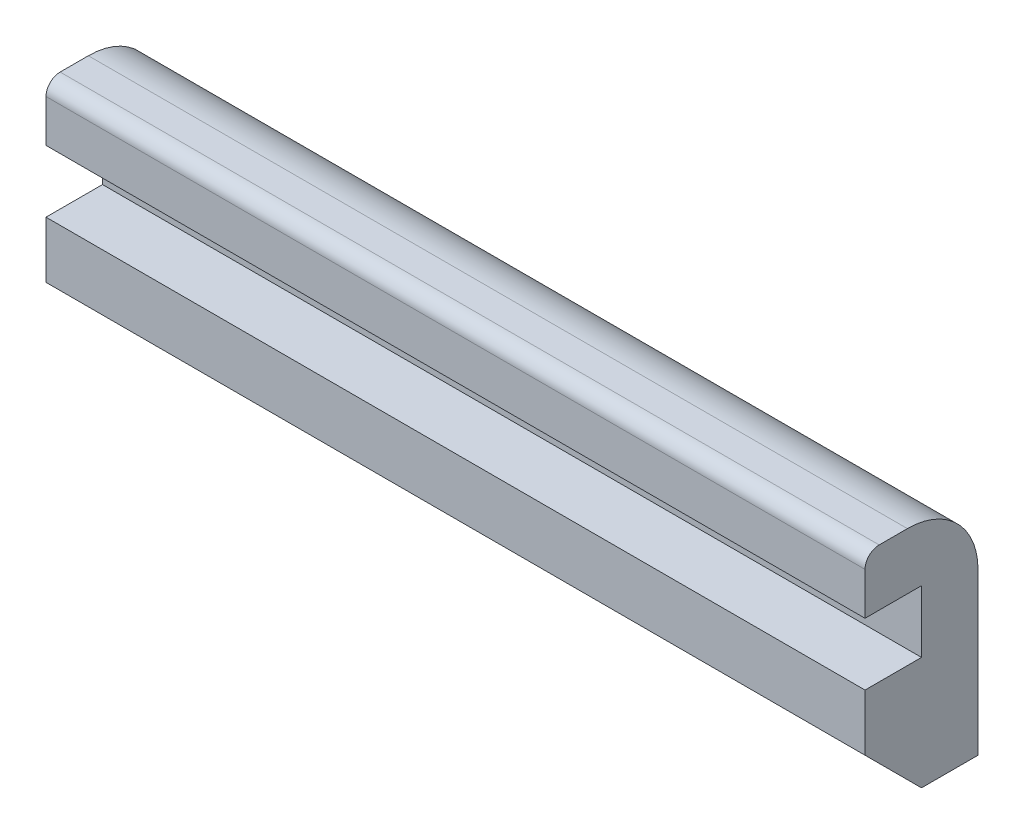
from build123d import *

# Parameters (mm, degrees)
SKETCH1_W                       = 39
SKETCH1_H                       = 155
BOSS_EXTRUDE1_DEPTH             = 2
BOSS_EXTRUDE2_DEPTH             = 38
SKETCH3_W                       = 2
SKETCH3_H                       = 2
BOSS_EXTRUDE3_DEPTH             = 38
SKETCH4_W                       = 2
SKETCH4_H                       = 2
BOSS_EXTRUDE4_DEPTH             = 151
SKETCH6_W                       = 35
SKETCH6_H                       = 2.2
CUT_EXTRUDE1_DEPTH              = 160.340045186
SKETCH7_W                       = 35
SKETCH7_H                       = 2.2
CUT_EXTRUDE2_DEPTH              = 89.490112442
SKETCH5_W                       = 31
SKETCH5_H                       = 2
BOSS_EXTRUDE5_DEPTH             = 2
BOSS_EXTRUDE6_REACH             = 91.367
SKETCH8_W                       = 2
SKETCH8_H                       = 2
BOSS_EXTRUDE6_DIRECTION_2_REACH = 91.367
SKETCH10_W                      = 2
SKETCH10_H                      = 2.2
SKETCH10_W_2                    = 2.2
SKETCH10_H_2                    = 2
BOSS_EXTRUDE8_DEPTH             = 2
SKETCH11_W                      = 2
SKETCH11_H                      = 2.2
SKETCH11_W_2                    = 2.2
SKETCH11_H_2                    = 2
BOSS_EXTRUDE9_DEPTH             = 2
FILLET2_R                       = 2.5
SKETCH14_W                      = 36.5
SKETCH14_H                      = 7.75
BOSS_EXTRUDE10_DEPTH            = 2
SKETCH13_W                      = 31
SKETCH13_H                      = 3
CUT_EXTRUDE4_DEPTH              = 2
FILLET3_R                       = 2
FILLET4_R                       = 0.5
SKETCH15_R                      = 5.1
CUT_EXTRUDE5_DEPTH              = 90.367219941
SKETCH16_R                      = 7.1
BOSS_EXTRUDE11_DEPTH            = 1
FILLET5_R                       = 0.5
CUT_EXTRUDE3_DEPTH              = 160.340045186
FILLET6_R                       = 0.4
FILLET7_R                       = 0.5
CUT_EXTRUDE6_DEPTH              = 6
SKETCH18_W                      = 29
SKETCH18_H                      = 3
CUT_EXTRUDE8_DEPTH              = 90.367220028
CUT_EXTRUDE11_DEPTH             = 90.367220028
CUT_EXTRUDE11_DEPTH_BACK        = 90.367220028
SKETCH20_W                      = 5
SKETCH20_H                      = 40
SKETCH21_W                      = 29
SKETCH21_H                      = 22.8
CUT_EXTRUDE12_DEPTH             = 43.594013669


with BuildPart() as part:
    # Sketch1 → Boss-Extrude1 (new body)
    with BuildSketch(Plane(origin=(0, 0, 0), x_dir=(1, 0, 0), z_dir=(0, 1, 0))):
        Rectangle(SKETCH1_W, SKETCH1_H)
    extrude(amount=BOSS_EXTRUDE1_DEPTH)

    # Sketch2 → Boss-Extrude2 (add)
    with BuildSketch(Plane(origin=(0, 2, 0), x_dir=(1, 0, 0), z_dir=(0, 1, 0))):
        Polygon((-17.5, -77.5), (-17.5, -75.5), (-17.5, 75.5), (17.5, 75.5), (17.5, -75.5), (17.5, -77.5), (19.5, -77.5), (19.5, 77.5), (-19.5, 77.5), (-19.5, -77.5), align=None)
    extrude(amount=BOSS_EXTRUDE2_DEPTH)

    # Sketch3 → Boss-Extrude3 (add)
    with BuildSketch(Plane(origin=(0, 2, 0), x_dir=(1, 0, 0), z_dir=(0, 1, 0))):
        with Locations((-16.5, -76.5)):
            Rectangle(SKETCH3_W, SKETCH3_H)
        with Locations((-16.5, -72.3)):
            Rectangle(SKETCH3_W, SKETCH3_H)
        with Locations((16.5, -76.5)):
            Rectangle(SKETCH3_W, SKETCH3_H)
        with Locations((16.5, -72.3)):
            Rectangle(SKETCH3_W, SKETCH3_H)
    extrude(amount=BOSS_EXTRUDE3_DEPTH)

    # Sketch4 → Boss-Extrude4 (add)
    with BuildSketch(Plane.XY.offset(-75.5)):
        with Locations((-16.5, 39)):
            Rectangle(SKETCH4_W, SKETCH4_H)
        Polygon((-15.5, 33.8), (-17.5, 31.8), (-17.5, 35.8), (-15.5, 35.8), align=None)
        Polygon((15.5, 35.8), (17.5, 35.8), (17.5, 31.8), (15.5, 33.8), align=None)
        with Locations((16.5, 39)):
            Rectangle(SKETCH4_W, SKETCH4_H)
    extrude(amount=BOSS_EXTRUDE4_DEPTH)

    # Sketch6 → Cut-Extrude1 (cut, through all)
    with BuildSketch(Plane.XY.offset(-75.5)):
        with Locations((0, 36.9)):
            Rectangle(SKETCH6_W, SKETCH6_H)
    extrude(amount=CUT_EXTRUDE1_DEPTH, mode=Mode.SUBTRACT)

    # Sketch7 → Cut-Extrude2 (cut, through all)
    with BuildSketch(Plane(origin=(0, 2, 0), x_dir=(1, 0, 0), z_dir=(0, 1, 0))):
        with Locations((0, -74.4)):
            Rectangle(SKETCH7_W, SKETCH7_H)
    extrude(amount=CUT_EXTRUDE2_DEPTH, mode=Mode.SUBTRACT)

    # Sketch5 → Boss-Extrude5 (add)
    with BuildSketch(Plane(origin=(0, 2, 0), x_dir=(1, 0, 0), z_dir=(0, 1, 0))):
        with Locations((0, -76.5)):
            Rectangle(SKETCH5_W, SKETCH5_H)
        with Locations((0, -72.3)):
            Rectangle(SKETCH5_W, SKETCH5_H)
    extrude(amount=BOSS_EXTRUDE5_DEPTH)

    # Boss-Extrude6: up to this face of the body (flat: up to its plane)
    boss_extrude6_end = Plane(part.part.faces().sort_by_distance((17.5, 16.9, -2.1))[0])
    # Sketch8 → Boss-Extrude6 (add, up to the picked face)
    with BuildSketch(Plane(origin=(0, 0, 0), x_dir=(0, 0, -1), z_dir=(1, 0, 0)), mode=Mode.PRIVATE) as boss_extrude6_sk1:
        with Locations((74.5, 39)):
            Rectangle(SKETCH8_W, SKETCH8_H)
    boss_extrude6_tool1 = split(extrude(boss_extrude6_sk1.sketch, amount=BOSS_EXTRUDE6_REACH, mode=Mode.PRIVATE), bisect_by=boss_extrude6_end, keep=Keep.BOTH, mode=Mode.PRIVATE)
    # Sketch8 → Boss-Extrude6 (add, up to the picked face)
    with BuildSketch(Plane(origin=(0, 0, 0), x_dir=(0, 0, -1), z_dir=(1, 0, 0)), mode=Mode.PRIVATE) as boss_extrude6_sk2:
        Polygon((75.5, 35.8), (73.5, 35.8), (73.5, 33.8), (75.5, 31.8), align=None)
    boss_extrude6_tool2 = split(extrude(boss_extrude6_sk2.sketch, amount=BOSS_EXTRUDE6_REACH, mode=Mode.PRIVATE), bisect_by=boss_extrude6_end, keep=Keep.BOTH, mode=Mode.PRIVATE)
    add(boss_extrude6_tool1.solids().sort_by(Axis((0, 39, -74.5), (1, 0, 0)))[0])
    add(boss_extrude6_tool2.solids().sort_by(Axis((0, 34.244444, -74.611111), (1, 0, 0)))[0])

    # Boss-Extrude6 direction 2: up to this face of the body (flat: up to its plane)
    boss_extrude6_direction_2_end = Plane(part.part.faces().sort_by_distance((-17.5, 16.9, -2.1))[0])
    # Sketch8 → Boss-Extrude6 direction 2 (add, up to the picked face)
    with BuildSketch(Plane(origin=(0, 0, 0), x_dir=(0, 0, -1), z_dir=(1, 0, 0)), mode=Mode.PRIVATE) as boss_extrude6_direction_2_sk1:
        with Locations((74.5, 39)):
            Rectangle(SKETCH8_W, SKETCH8_H)
    boss_extrude6_direction_2_tool1 = split(extrude(boss_extrude6_direction_2_sk1.sketch, amount=-BOSS_EXTRUDE6_DIRECTION_2_REACH, mode=Mode.PRIVATE), bisect_by=boss_extrude6_direction_2_end, keep=Keep.BOTH, mode=Mode.PRIVATE)
    # Sketch8 → Boss-Extrude6 direction 2 (add, up to the picked face)
    with BuildSketch(Plane(origin=(0, 0, 0), x_dir=(0, 0, -1), z_dir=(1, 0, 0)), mode=Mode.PRIVATE) as boss_extrude6_direction_2_sk2:
        Polygon((75.5, 35.8), (73.5, 35.8), (73.5, 33.8), (75.5, 31.8), align=None)
    boss_extrude6_direction_2_tool2 = split(extrude(boss_extrude6_direction_2_sk2.sketch, amount=-BOSS_EXTRUDE6_DIRECTION_2_REACH, mode=Mode.PRIVATE), bisect_by=boss_extrude6_direction_2_end, keep=Keep.BOTH, mode=Mode.PRIVATE)
    add(boss_extrude6_direction_2_tool1.solids().sort_by(Axis((0, 39, -74.5), (-1, 0, 0)))[0])
    add(boss_extrude6_direction_2_tool2.solids().sort_by(Axis((0, 34.244444, -74.611111), (-1, 0, 0)))[0])

    # Sketch10 → Boss-Extrude8 (add)
    with BuildSketch(Plane(origin=(-17.5, 0, 0), x_dir=(0, 0, -1), z_dir=(1, 0, 0))):
        with Locations((-76.5, 36.9)):
            Rectangle(SKETCH10_W, SKETCH10_H)
        with Locations((-74.4, 39)):
            Rectangle(SKETCH10_W_2, SKETCH10_H_2)
    extrude(amount=BOSS_EXTRUDE8_DEPTH)

    # Sketch11 → Boss-Extrude9 (add)
    with BuildSketch(Plane.ZY.offset(-17.5)):
        with Locations((76.5, 36.9)):
            Rectangle(SKETCH11_W, SKETCH11_H)
        with Locations((74.4, 39)):
            Rectangle(SKETCH11_W_2, SKETCH11_H_2)
    extrude(amount=BOSS_EXTRUDE9_DEPTH)

    # Fillet2
    fillet2_edges = [part.edges().sort_by_distance(p)[0] for p in [
        (-17.5, 16.9, 71.3),
        (17.5, 16.9, 71.3),
        (19.5, 20, 77.5),
        (-19.5, 20, 77.5),
        (-19.5, 20, -77.5),
        (-17.5, 16.9, -75.5),
        (17.5, 16.9, -75.5),
        (19.5, 20, -77.5),
        (19.5, 40, 0),
        (-19.5, 40, 0),
        (19.5, 0, 0),
        (-19.5, 0, 0),
        (0, 40, -77.5),
        (0, 0, 77.5),
        (0, 0, -77.5),
        (-17.5, 40, 77.5),
        (17.5, 40, 77.5),
    ]]
    fillet(fillet2_edges, radius=FILLET2_R)

    # Sketch14 → Boss-Extrude10 (add)
    with BuildSketch(Plane.XY.offset(-75.5)):
        with Locations((0, 5.125)):
            Rectangle(SKETCH14_W, SKETCH14_H)
    extrude(amount=BOSS_EXTRUDE10_DEPTH)

    # Sketch13 → Cut-Extrude4 (cut)
    with BuildSketch(Plane(origin=(0, 0, -77.5), x_dir=(-1, 0, 0), z_dir=(0, 0, -1))):
        with Locations((0, 5.5)):
            Rectangle(SKETCH13_W, SKETCH13_H)
    extrude(amount=-CUT_EXTRUDE4_DEPTH, mode=Mode.SUBTRACT)

    # Fillet3
    fillet3_edges = [part.edges().sort_by_distance(p)[0] for p in [
        (0, 9, -73.5),
    ]]
    fillet(fillet3_edges, radius=FILLET3_R - 0.0001)  # a hair under: the kernel refuses the full size

    # Fillet4
    fillet4_edges = [part.edges().sort_by_distance(p)[0] for p in [
        (15.5, 5.5, -75.5),
        (15.5, 4, -76.5),
        (0, 7, -75.5),
        (15.5, 7, -76.5),
        (-15.5, 5.5, -75.5),
        (-15.5, 7, -76.5),
        (0, 4, -75.5),
        (-15.5, 4, -76.5),
        (15.5, 5.5, -77.5),
        (0, 4, -77.5),
        (-15.5, 5.5, -77.5),
        (0, 7, -77.5),
    ]]
    fillet(fillet4_edges, radius=FILLET4_R)

    # Sketch15 → Cut-Extrude5 (cut, through all)
    with BuildSketch(Plane.XZ):
        with Locations(Location((0, 38.75, 0), (0, 0, 270))):
            Circle(SKETCH15_R)
        with Locations(Location((0, -38.75, 0), (0, 0, 270))):
            Circle(SKETCH15_R)
    extrude(amount=-CUT_EXTRUDE5_DEPTH, mode=Mode.SUBTRACT)

    # Sketch16 → Boss-Extrude11 (add)
    with BuildSketch(Plane(origin=(0, 2, 0), x_dir=(1, 0, 0), z_dir=(0, 1, 0))):
        with Locations(Location((0, 38.75, 0), (0, 0, 270))):
            Circle(SKETCH16_R)
        with Locations(Location((0, -38.75, 0), (0, 0, 270))):
            Circle(SKETCH16_R)
    extrude(amount=BOSS_EXTRUDE11_DEPTH)

    # Fillet5
    fillet5_edges = [part.edges().sort_by_distance(p)[0] for p in [
        (0, 2, -45.85),
        (0, 3, -45.85),
        (0, 2, 31.65),
        (0, 3, 31.65),
    ]]
    fillet(fillet5_edges, radius=FILLET5_R - 0.0001)  # a hair under: the kernel refuses the full size

    # Sketch12 → Cut-Extrude3 (cut, through all)
    with BuildSketch(Plane.XY.offset(-75.5)):
        with BuildLine():
            Line((1.668907005, 12.688040659), (2.22520934, 10.250720878))
            ThreePointArc((2.22520934, 10.250720878), (4.338837391, 10.990311321), (6.234898019, 12.181685175))
            Line((6.234898019, 12.181685175), (4.676173514, 14.136263881))
            ThreePointArc((4.676173514, 14.136263881), (3.254128043, 13.242733491), (1.668907005, 12.688040659))
        make_face()
        with BuildLine():
            ThreePointArc((-6.234898019, 12.181685175), (-4.338837391, 10.990311321), (-2.22520934, 10.250720878))
            Line((-2.22520934, 10.250720878), (-1.668907005, 12.688040659))
            ThreePointArc((-1.668907005, 12.688040659), (-3.254128043, 13.242733491), (-4.676173514, 14.136263881))
            Line((-4.676173514, 14.136263881), (-6.234898019, 12.181685175))
        make_face()
        with BuildLine():
            ThreePointArc((-10, 20), (-9.749279122, 17.77479066), (-9.009688679, 15.661162609))
            Line((-9.009688679, 15.661162609), (-6.757266509, 16.745871957))
            ThreePointArc((-6.757266509, 16.745871957), (-7.311959341, 18.331092995), (-7.5, 20))
            Line((-7.5, 20), (-10, 20))
        make_face()
        with BuildLine():
            ThreePointArc((-6.234898019, 27.818314825), (-7.818314825, 26.234898019), (-9.009688679, 24.338837391))
            Line((-9.009688679, 24.338837391), (-6.757266509, 23.254128043))
            ThreePointArc((-6.757266509, 23.254128043), (-5.863736119, 24.676173514), (-4.676173514, 25.863736119))
            Line((-4.676173514, 25.863736119), (-6.234898019, 27.818314825))
        make_face()
        with BuildLine():
            ThreePointArc((-1.668907005, 27.311959341), (-0.839733571, 27.452841574), (0, 27.5))
            Line((0, 27.5), (0, 30))
            ThreePointArc((0, 30), (-1.119644761, 29.937122099), (-2.22520934, 29.749279122))
            Line((-2.22520934, 29.749279122), (-1.668907005, 27.311959341))
        make_face()
        with BuildLine():
            Line((0, 30), (0, 27.5))
            ThreePointArc((0, 27.5), (0.839733571, 27.452841574), (1.668907005, 27.311959341))
            Line((1.668907005, 27.311959341), (2.22520934, 29.749279122))
            ThreePointArc((2.22520934, 29.749279122), (1.119644761, 29.937122099), (0, 30))
        make_face()
        with BuildLine():
            Line((6.757266509, 23.254128043), (9.009688679, 24.338837391))
            ThreePointArc((9.009688679, 24.338837391), (7.818314825, 26.234898019), (6.234898019, 27.818314825))
            Line((6.234898019, 27.818314825), (4.676173514, 25.863736119))
            ThreePointArc((4.676173514, 25.863736119), (5.863736119, 24.676173514), (6.757266509, 23.254128043))
        make_face()
        with BuildLine():
            Line((6.757266509, 16.745871957), (9.009688679, 15.661162609))
            ThreePointArc((9.009688679, 15.661162609), (9.749279122, 17.77479066), (10, 20))
            Line((10, 20), (7.5, 20))
            ThreePointArc((7.5, 20), (7.311959341, 18.331092995), (6.757266509, 16.745871957))
        make_face()
        with BuildLine():
            ThreePointArc((2.5, 20), (2.43731978, 19.443697665), (2.25242217, 18.915290652))
            Line((2.25242217, 18.915290652), (4.50484434, 17.830581304))
            ThreePointArc((4.50484434, 17.830581304), (4.874639561, 18.88739533), (5, 20))
            Line((5, 20), (2.5, 20))
        make_face()
        with BuildLine():
            ThreePointArc((1.558724505, 21.954578706), (1.954578706, 21.558724505), (2.25242217, 21.084709348))
            Line((2.25242217, 21.084709348), (4.50484434, 22.169418696))
            ThreePointArc((4.50484434, 22.169418696), (3.909157412, 23.117449009), (3.117449009, 23.909157412))
            Line((3.117449009, 23.909157412), (1.558724505, 21.954578706))
        make_face()
        with BuildLine():
            Line((0, 25), (0, 22.5))
            ThreePointArc((0, 22.5), (0.27991119, 22.484280525), (0.556302335, 22.43731978))
            Line((0.556302335, 22.43731978), (1.11260467, 24.874639561))
            ThreePointArc((1.11260467, 24.874639561), (0.559822381, 24.968561049), (0, 25))
        make_face()
        with BuildLine():
            ThreePointArc((-0.556302335, 22.43731978), (-0.27991119, 22.484280525), (0, 22.5))
            Line((0, 22.5), (0, 25))
            ThreePointArc((0, 25), (-0.559822381, 24.968561049), (-1.11260467, 24.874639561))
            Line((-1.11260467, 24.874639561), (-0.556302335, 22.43731978))
        make_face()
        with BuildLine():
            ThreePointArc((-2.25242217, 21.084709348), (-1.954578706, 21.558724505), (-1.558724505, 21.954578706))
            Line((-1.558724505, 21.954578706), (-3.117449009, 23.909157412))
            ThreePointArc((-3.117449009, 23.909157412), (-3.909157412, 23.117449009), (-4.50484434, 22.169418696))
            Line((-4.50484434, 22.169418696), (-2.25242217, 21.084709348))
        make_face()
        with BuildLine():
            ThreePointArc((-2.25242217, 18.915290652), (-2.43731978, 19.443697665), (-2.5, 20))
            Line((-2.5, 20), (-5, 20))
            ThreePointArc((-5, 20), (-4.874639561, 18.88739533), (-4.50484434, 17.830581304))
            Line((-4.50484434, 17.830581304), (-2.25242217, 18.915290652))
        make_face()
        with BuildLine():
            ThreePointArc((-3.117449009, 16.090842588), (-2.169418696, 15.49515566), (-1.11260467, 15.125360439))
            Line((-1.11260467, 15.125360439), (-0.556302335, 17.56268022))
            ThreePointArc((-0.556302335, 17.56268022), (-1.084709348, 17.74757783), (-1.558724505, 18.045421294))
            Line((-1.558724505, 18.045421294), (-3.117449009, 16.090842588))
        make_face()
        with BuildLine():
            Line((0.556302335, 17.56268022), (1.11260467, 15.125360439))
            ThreePointArc((1.11260467, 15.125360439), (2.169418696, 15.49515566), (3.117449009, 16.090842588))
            Line((3.117449009, 16.090842588), (1.558724505, 18.045421294))
            ThreePointArc((1.558724505, 18.045421294), (1.084709348, 17.74757783), (0.556302335, 17.56268022))
        make_face()
    extrude(amount=-CUT_EXTRUDE3_DEPTH, mode=Mode.SUBTRACT)

    # Fillet6
    fillet6_edges = [part.edges().sort_by_distance(p)[0] for p in [
        (5.863736119, 24.676173514, -75.5),
        (5.455535766, 26.841025472, -75.5),
        (7.818314825, 26.234898019, -77.5),
        (7.883477594, 23.796482717, -77.5),
        (5.863736119, 24.676173514, -77.5),
        (5.455535766, 26.841025472, -77.5),
        (7.883477594, 23.796482717, -75.5),
        (7.818314825, 26.234898019, -75.5),
        (7.311959341, 18.331092995, -75.5),
        (8.75, 20, -75.5),
        (9.749279122, 17.77479066, -77.5),
        (7.883477594, 16.203517283, -77.5),
        (7.311959341, 18.331092995, -77.5),
        (8.75, 20, -77.5),
        (7.883477594, 16.203517283, -75.5),
        (9.749279122, 17.77479066, -75.5),
        (2.43731978, 19.443697665, -75.5),
        (3.75, 20, -75.5),
        (4.874639561, 18.88739533, -77.5),
        (3.378633255, 18.372935978, -77.5),
        (2.43731978, 19.443697665, -77.5),
        (3.75, 20, -77.5),
        (3.378633255, 18.372935978, -75.5),
        (4.874639561, 18.88739533, -75.5),
        (1.954578706, 21.558724505, -75.5),
        (2.338086757, 22.931868059, -75.5),
        (3.909157412, 23.117449009, -77.5),
        (3.378633255, 21.627064022, -77.5),
        (1.954578706, 21.558724505, -77.5),
        (2.338086757, 22.931868059, -77.5),
        (3.378633255, 21.627064022, -75.5),
        (3.909157412, 23.117449009, -75.5),
        (0, 27.5, -75.5),
        (-1.947058172, 28.530619232, -75.5),
        (0, 30, -77.5),
        (1.947058172, 28.530619232, -77.5),
        (0, 27.5, -77.5),
        (-1.947058172, 28.530619232, -77.5),
        (1.947058172, 28.530619232, -75.5),
        (0, 30, -75.5),
        (-5.863736119, 24.676173514, -75.5),
        (-7.883477594, 23.796482717, -75.5),
        (-7.818314825, 26.234898019, -77.5),
        (-5.455535766, 26.841025472, -77.5),
        (-5.863736119, 24.676173514, -77.5),
        (-7.883477594, 23.796482717, -77.5),
        (-5.455535766, 26.841025472, -75.5),
        (-7.818314825, 26.234898019, -75.5),
        (-7.311959341, 18.331092995, -75.5),
        (-7.883477594, 16.203517283, -75.5),
        (-9.749279122, 17.77479066, -77.5),
        (-8.75, 20, -77.5),
        (-7.311959341, 18.331092995, -77.5),
        (-7.883477594, 16.203517283, -77.5),
        (-8.75, 20, -75.5),
        (-9.749279122, 17.77479066, -75.5),
        (-3.254128043, 13.242733491, -75.5),
        (-1.947058172, 11.469380768, -75.5),
        (-4.338837391, 10.990311321, -77.5),
        (-5.455535766, 13.158974528, -77.5),
        (-3.254128043, 13.242733491, -77.5),
        (-1.947058172, 11.469380768, -77.5),
        (-5.455535766, 13.158974528, -75.5),
        (-4.338837391, 10.990311321, -75.5),
        (1.084709348, 17.74757783, -75.5),
        (2.338086757, 17.068131941, -75.5),
        (2.169418696, 15.49515566, -77.5),
        (0.834453502, 16.344020329, -77.5),
        (1.084709348, 17.74757783, -77.5),
        (2.338086757, 17.068131941, -77.5),
        (0.834453502, 16.344020329, -75.5),
        (2.169418696, 15.49515566, -75.5),
        (-2.43731978, 19.443697665, -75.5),
        (-3.378633255, 18.372935978, -75.5),
        (-4.874639561, 18.88739533, -77.5),
        (-3.75, 20, -77.5),
        (-2.43731978, 19.443697665, -77.5),
        (-3.378633255, 18.372935978, -77.5),
        (-3.75, 20, -75.5),
        (-4.874639561, 18.88739533, -75.5),
        (-1.084709348, 17.74757783, -75.5),
        (-0.834453502, 16.344020329, -75.5),
        (-2.169418696, 15.49515566, -77.5),
        (-2.338086757, 17.068131941, -77.5),
        (-1.084709348, 17.74757783, -77.5),
        (-0.834453502, 16.344020329, -77.5),
        (-2.338086757, 17.068131941, -75.5),
        (-2.169418696, 15.49515566, -75.5),
        (-1.954578706, 21.558724505, -75.5),
        (-3.378633255, 21.627064022, -75.5),
        (-3.909157412, 23.117449009, -77.5),
        (-2.338086757, 22.931868059, -77.5),
        (-1.954578706, 21.558724505, -77.5),
        (-3.378633255, 21.627064022, -77.5),
        (-2.338086757, 22.931868059, -75.5),
        (-3.909157412, 23.117449009, -75.5),
        (0, 25, -77.5),
        (0.834453502, 23.655979671, -77.5),
        (0, 22.5, -75.5),
        (-0.834453502, 23.655979671, -75.5),
        (0, 22.5, -77.5),
        (-0.834453502, 23.655979671, -77.5),
        (0, 25, -75.5),
        (0.834453502, 23.655979671, -75.5),
        (3.254128043, 13.242733491, -75.5),
        (5.455535766, 13.158974528, -75.5),
        (4.338837391, 10.990311321, -77.5),
        (1.947058172, 11.469380768, -77.5),
        (3.254128043, 13.242733491, -77.5),
        (5.455535766, 13.158974528, -77.5),
        (1.947058172, 11.469380768, -75.5),
        (4.338837391, 10.990311321, -75.5),
    ]]
    fillet(fillet6_edges, radius=FILLET6_R)

    # Fillet7
    fillet7_edges = [part.edges().sort_by_distance(p)[0] for p in [
        (15.5, 40, 0.75),
        (0, 4, 77.5),
        (0, 40, -73.5),
        (-15.5, 40, 0.75),
        (-15.5, 20.75, 77.5),
        (-15.5, 39.267766953, 76.767766953),
        (15.5, 20.75, 77.5),
        (15.5, 39.267766953, 76.767766953),
    ]]
    fillet(fillet7_edges, radius=FILLET7_R)

    # Sketch17 → Cut-Extrude6 (cut)
    with BuildSketch(Plane.XZ):
        Polygon((-17, -77.5), (-17, 70.299999999), (-14.999999999, 71.3), (-14.999999999, 77.5), (14.999999999, 77.5), (14.999999999, 71.3), (17, 70.299999999), (17, -77.5), align=None)
    extrude(amount=-CUT_EXTRUDE6_DEPTH, mode=Mode.SUBTRACT)

    # Sketch18 → Cut-Extrude8 (cut, through all)
    with BuildSketch(Plane.XY):
        with Locations((0, 7.5)):
            Rectangle(SKETCH18_W, SKETCH18_H)
    extrude(amount=-CUT_EXTRUDE8_DEPTH, mode=Mode.SUBTRACT)

    # Sketch20 → Cut-Extrude11 (cut, two sides: drawn at the far end of the back side and taken through both)
    with BuildSketch(Plane.XY.offset(-CUT_EXTRUDE11_DEPTH_BACK)):
        Polygon((19.5, 40), (14.5, 40), (14.5, 6), (14.5, 0), (19.5, 0), align=None)
        with Locations((-17, 20)):
            Rectangle(SKETCH20_W, SKETCH20_H)
    extrude(amount=CUT_EXTRUDE11_DEPTH + CUT_EXTRUDE11_DEPTH_BACK, mode=Mode.SUBTRACT)

    # Sketch21 → Cut-Extrude12 (cut, through all)
    with BuildSketch(Plane.XY.offset(-75.5)):
        with Locations((0, 20.4)):
            Rectangle(SKETCH21_W, SKETCH21_H)
    extrude(amount=-CUT_EXTRUDE12_DEPTH, mode=Mode.SUBTRACT)


solid = part.part
